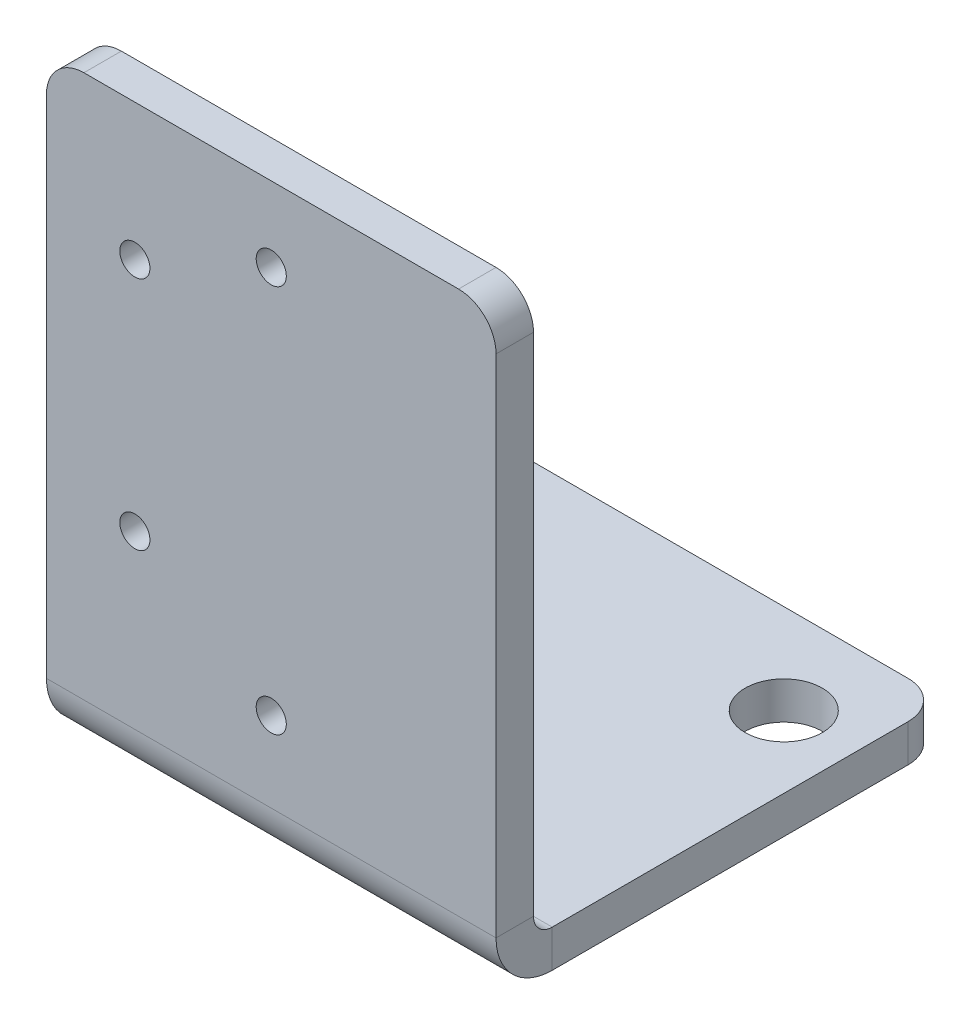
from build123d import *

# Parameters (mm, degrees)
BASE_FLANGE1_DEPTH = 76.2
SKETCH3_R          = 6.5405
TAB1_DEPTH         = 6.35
SKETCH3_2_R        = 6.5405
CUT_EXTRUDE1_DEPTH = 12.7
SKETCH4_R          = 2.5527
CUT_EXTRUDE2_DEPTH = 12.7
FILLET1_R          = 6.35


# Sheet-metal steps are written as plain solids
with BuildPart() as part:
    # Sketch1 → Base-Flange1 (new body)
    with BuildSketch(Plane(origin=(0, 0, 0), x_dir=(0, 0, -1), z_dir=(1, 0, 0))):
        with BuildLine():
            Line((76.2, 0), (9.525, 0))
            ThreePointArc((9.525, 0), (2.789807909, 2.789807909), (0, 9.525))
            Line((0, 9.525), (0, 101.6))
            Line((0, 101.6), (6.35, 101.6))
            Line((6.35, 101.6), (6.35, 9.525))
            ThreePointArc((6.35, 9.525), (7.27993597, 7.27993597), (9.525, 6.35))
            Line((9.525, 6.35), (76.2, 6.35))
            Line((76.2, 6.35), (76.2, 0))
        make_face()
    extrude(amount=BASE_FLANGE1_DEPTH)

    # Sketch3 → Tab1 (add)
    with BuildSketch(Plane(origin=(0, 6.35, 0), x_dir=(-1, 0, 0), z_dir=(0, 1, 0))):
        with Locations((-12.1158, -24.384)):
            Circle(SKETCH3_R)
        with Locations((-64.008, -60.96)):
            Circle(SKETCH3_R)
    extrude(amount=-TAB1_DEPTH)

    # Sketch3<2> → Cut-Extrude1 (cut)
    with BuildSketch(Plane(origin=(0, 6.35, 0), x_dir=(-1, 0, 0), z_dir=(0, 1, 0))):
        with Locations(Location((-12.1158, -24.384, 0), (0, 0, 90))):
            Circle(SKETCH3_2_R)
        with Locations(Location((-64.008, -60.96, 0), (0, 0, 90))):
            Circle(SKETCH3_2_R)
    extrude(amount=-CUT_EXTRUDE1_DEPTH, mode=Mode.SUBTRACT)

    # Sketch4 → Cut-Extrude2 (cut)
    with BuildSketch(Plane(origin=(0, 0, -6.35), x_dir=(-1, 0, 0), z_dir=(0, 0, -1))):
        with Locations((-38.1, 88.9)):
            Circle(SKETCH4_R)
        with Locations((-38.1, 23.114)):
            Circle(SKETCH4_R)
        with Locations((-14.986, 78.486)):
            Circle(SKETCH4_R)
        with Locations((-14.986, 38.608)):
            Circle(SKETCH4_R)
    extrude(amount=-CUT_EXTRUDE2_DEPTH, mode=Mode.SUBTRACT)

    # Fillet1
    fillet1_edges = [part.edges().sort_by_distance(p)[0] for p in [
        (76.2, 101.6, -3.175),
        (0, 101.6, -3.175),
        (76.2, 3.175, -76.2),
        (0, 3.175, -76.2),
    ]]
    fillet(fillet1_edges, radius=FILLET1_R)


solid = part.part
